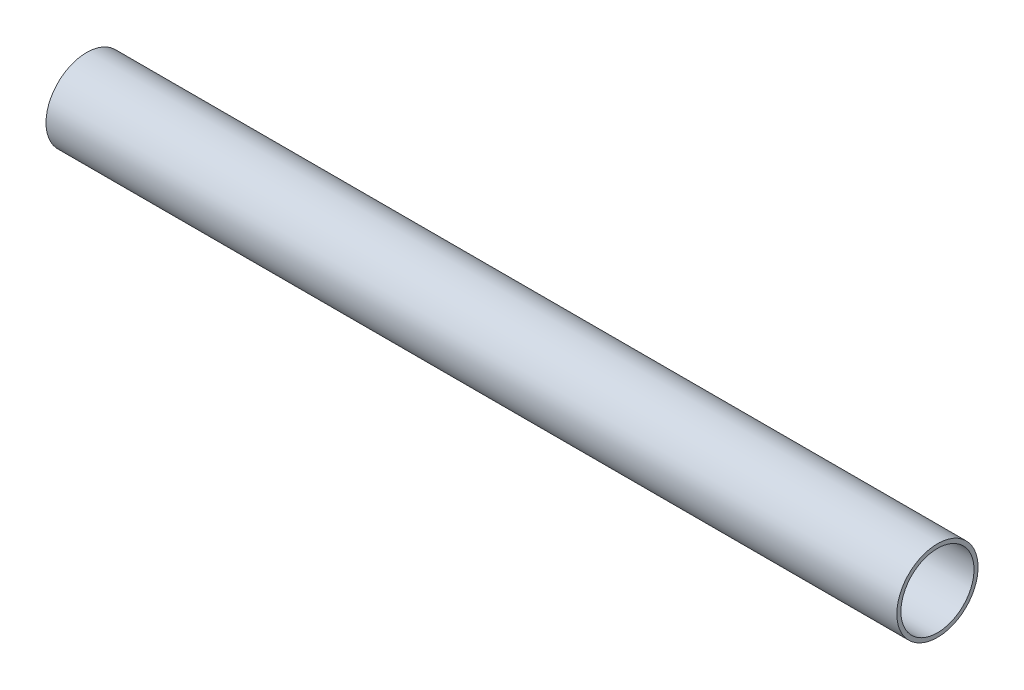
from build123d import *

# Parameters (mm, degrees)
SKETCH1_R           = 15.875
SKETCH1_R_2         = 14.2875
EXTRUDE_THIN1_DEPTH = 166.290625


with BuildPart() as part:
    # Sketch1 → Extrude-Thin1 (new, symmetric)
    with BuildSketch(Plane(origin=(0, 0, 0), x_dir=(0, 0, -1), z_dir=(1, 0, 0))):
        Circle(SKETCH1_R)
        Circle(SKETCH1_R_2, mode=Mode.SUBTRACT)
    extrude(amount=EXTRUDE_THIN1_DEPTH, both=True)


solid = part.part
